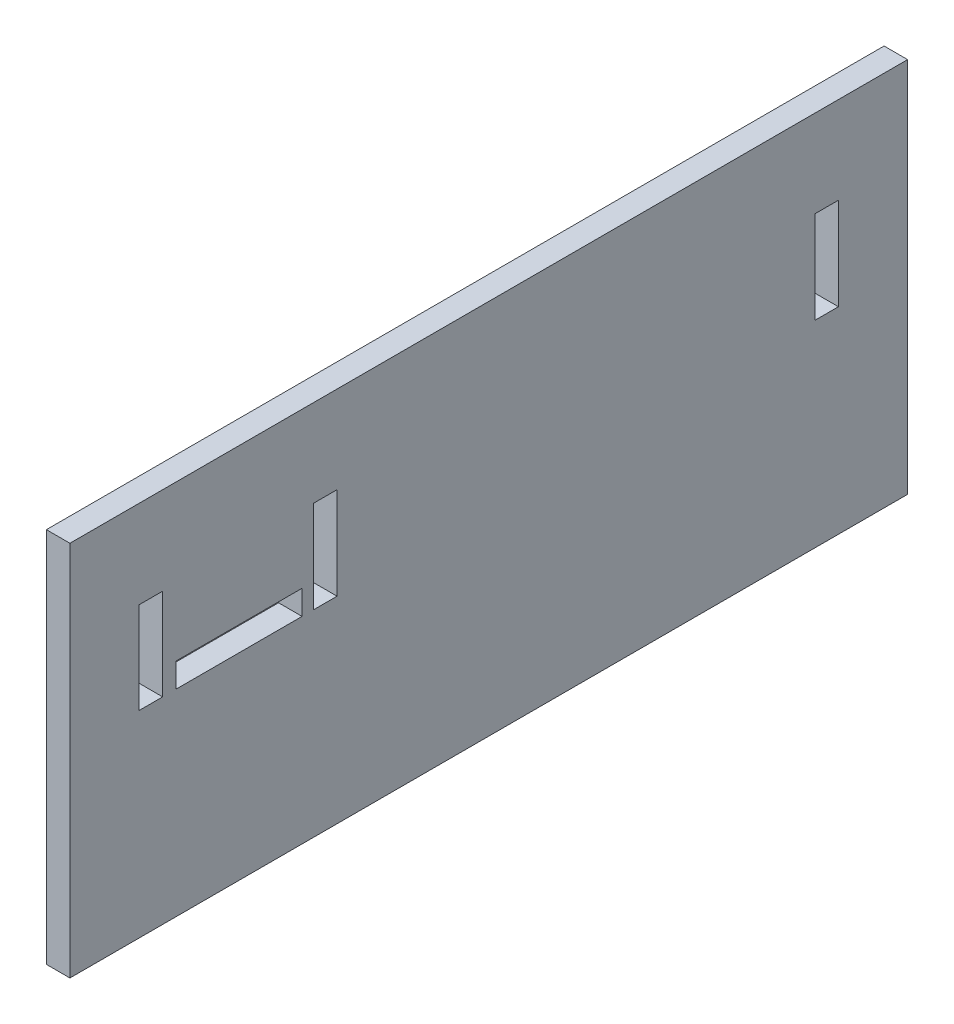
from build123d import *

# Parameters (mm, degrees)
SKETCH1_W   = 2.7
SKETCH1_H   = 10.5
SKETCH1_H_2 = 10.579195959
SKETCH1_W_2 = 14.478
SKETCH1_H_3 = 2.794
PANEL_DEPTH = 2.7


with BuildPart() as part:
    # Sketch1 → Panel (new body)
    with BuildSketch(Plane(origin=(0, 0, 0), x_dir=(0, 0, -1), z_dir=(1, 0, 0))):
        Polygon((3.2125, 30.5), (83.4125, 30.5), (94.9125, 30.5), (94.9125, -12.68), (86.975, -12.68), (6.775, -12.68), (-1.1625, -12.68), (-1.1625, 30.5), align=None)
        with Locations((8.125, 15.172642531)):
            Rectangle(SKETCH1_W, SKETCH1_H, mode=Mode.SUBTRACT)
        with Locations((85.625, 15.212240511)):
            Rectangle(SKETCH1_W, SKETCH1_H_2, mode=Mode.SUBTRACT)
        with Locations((18.225035172, 11.319642531)):
            Rectangle(SKETCH1_W_2, SKETCH1_H_3, mode=Mode.SUBTRACT)
        with Locations((28.125, 15.212240511)):
            Rectangle(SKETCH1_W, SKETCH1_H_2, mode=Mode.SUBTRACT)
    extrude(amount=PANEL_DEPTH)


solid = part.part
